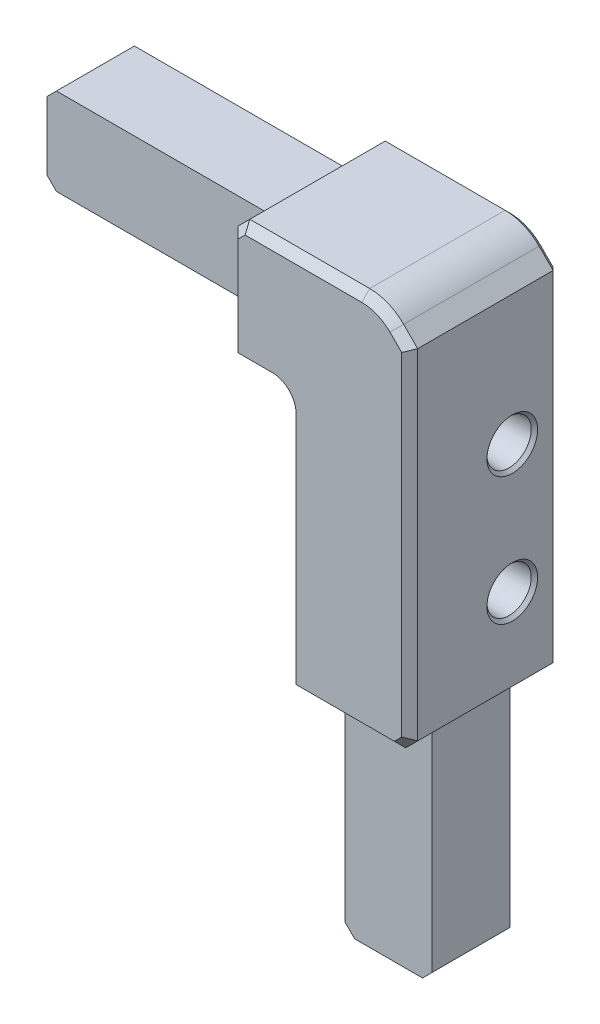
from build123d import *

# Parameters (mm, degrees)
BODY_DEPTH                   = 5.71
SIDE_TONGUE_SKETCH_W         = 10.88
SIDE_TONGUE_SKETCH_H         = 31
SIDE_TONGUE_DEPTH            = 4.875
END_TONGUE_SKETCH_W          = 31
END_TONGUE_SKETCH_H          = 10.88
END_TONGUE_DEPTH             = 4.875
WEB_DEPTH                    = 9.27
LIP_DEPTH                    = 1.81
BUMPER_CORNER_BED_SIDE_SIZE  = 3.516
BUMPER_CORNER_R              = 6
SHEET_CORNER_RELIEF_SKETCH_R = 1
SHEET_CORNER_RELIEF_DEPTH    = 1.75
REVEAL_CORNER_R              = 2
BODY_INSIDE_CORNER_R         = 2
ARM_ENDS_SIZE                = 1.5
TONGUE_LEAD_IN_SIZE          = 1.2
FRONT_FACE_CHAMFER_SIZE      = 1
BACK_FACE_CHAMFER_SIZE       = 0.6


with BuildPart() as part:
    # body sketch → body (new, symmetric)
    with BuildSketch(Plane.XY.offset(19.54)):
        Polygon((4.42, 7.07), (-18.08, 7.07), (-18.08, -8.13), (-10.78, -8.13), (-10.78, -40.43), (4.42, -40.43), align=None)
    extrude(amount=BODY_DEPTH, both=True)

    # side tongue sketch → side tongue (add, symmetric)
    with BuildSketch(Plane.XY.offset(20.375)):
        with Locations((-5.34, -54.93)):
            Rectangle(SIDE_TONGUE_SKETCH_W, SIDE_TONGUE_SKETCH_H)
    extrude(amount=SIDE_TONGUE_DEPTH, both=True)

    # end tongue sketch → end tongue (add, symmetric)
    with BuildSketch(Plane.XY.offset(20.375)):
        with Locations((-32.58, -2.69)):
            Rectangle(END_TONGUE_SKETCH_W, END_TONGUE_SKETCH_H)
    extrude(amount=END_TONGUE_DEPTH, both=True)

    # web sketch → web (add, symmetric)
    with BuildSketch(Plane.XY.offset(23.1)):
        Polygon((4.42, 7.07), (-18.08, 7.07), (-18.08, 3), (0.35, 3), (0.35, -40.43), (4.42, -40.43), align=None)
    extrude(amount=WEB_DEPTH, both=True)

    # lip sketch → lip (add, symmetric)
    with BuildSketch(Plane.XY.offset(30.56)):
        Polygon((4.42, 7.07), (-18.08, 7.07), (-18.08, -8.13), (-10.78, -8.13), (-10.78, -40.43), (4.42, -40.43), align=None)
    extrude(amount=LIP_DEPTH, both=True)

    # insert hole 1 sketch → insert hole 1 (revolve, cut)
    with BuildSketch(Plane.XY.offset(19.54)):
        Polygon((-3.58, -28.7), (5.42, -28.7), (5.42, -24.530439128), (4.02, -25.930439128), (-1.98, -26.35), (-3.58, -26.35), align=None)
    revolve(axis=Axis((-3.58, -28.7, 19.54), (1, 0, 0)), mode=Mode.SUBTRACT)

    # insert hole 2 sketch → insert hole 2 (revolve, cut)
    with BuildSketch(Plane.XY.offset(19.54)):
        Polygon((-3.58, -12.7), (5.42, -12.7), (5.42, -8.530439128), (4.02, -9.930439128), (-1.98, -10.35), (-3.58, -10.35), align=None)
    revolve(axis=Axis((-3.58, -12.7, 19.54), (1, 0, 0)), mode=Mode.SUBTRACT)

    # bumper corner, bed side
    bumper_corner_bed_side_edges = [part.edges().sort_by_distance(p)[0] for p in [
        (4.42, 7.07, 23.1),
    ]]
    chamfer(bumper_corner_bed_side_edges, length=BUMPER_CORNER_BED_SIDE_SIZE)

    # bumper corner
    bumper_corner_edges = [part.edges().sort_by_distance(p)[0] for p in [
        (0.904, 7.07, 23.1),
    ]]
    fillet(bumper_corner_edges, radius=BUMPER_CORNER_R)

    # sheet corner relief sketch → sheet corner relief (cut, symmetric)
    with BuildSketch(Plane.XY.offset(27)):
        with Locations((0.35, 3)):
            Circle(SHEET_CORNER_RELIEF_SKETCH_R)
    extrude(amount=SHEET_CORNER_RELIEF_DEPTH, both=True, mode=Mode.SUBTRACT)

    # reveal corner
    reveal_corner_edges = [part.edges().sort_by_distance(p)[0] for p in [
        (-10.78, -8.13, 30.56),
    ]]
    fillet(reveal_corner_edges, radius=REVEAL_CORNER_R)

    # body inside corner
    body_inside_corner_edges = [part.edges().sort_by_distance(p)[0] for p in [
        (-10.78, -8.13, 19.54),
    ]]
    fillet(body_inside_corner_edges, radius=BODY_INSIDE_CORNER_R)

    # arm ends
    arm_ends_edges = [part.edges().sort_by_distance(p)[0] for p in [
        (-18.08, 7.07, 23.1),
        (4.42, -40.43, 23.1),
    ]]
    chamfer(arm_ends_edges, length=ARM_ENDS_SIZE)

    # tongue lead-in
    tongue_lead_in_edges = [part.edges().sort_by_distance(p)[0] for p in [
        (-48.08, -8.13, 20.375),
        (-48.08, 2.75, 20.375),
        (-10.78, -70.43, 20.375),
        (0.1, -70.43, 20.375),
    ]]
    chamfer(tongue_lead_in_edges, length=TONGUE_LEAD_IN_SIZE)

    # front face chamfer
    front_face_chamfer_edges = [part.edges().sort_by_distance(p)[0] for p in [
        (0.71481922, 6.613277195, 32.37),
        (3.540679656, 4.433320344, 32.37),
        (4.42, -17.688, 32.37),
        (3.67, -39.68, 32.37),
        (-3.93, -40.43, 32.37),
        (-10.78, -25.28, 32.37),
        (-11.365786438, -8.715786438, 32.37),
        (-15.43, -8.13, 32.37),
        (-18.08, -1.28, 32.37),
        (-17.33, 6.32, 32.37),
        (-9.080640687, 7.07, 32.37),
    ]]
    chamfer(front_face_chamfer_edges, length=FRONT_FACE_CHAMFER_SIZE)

    # back face chamfer
    back_face_chamfer_edges = [part.edges().sort_by_distance(p)[0] for p in [
        (-15.43, -8.13, 13.83),
        (-11.365786438, -8.715786438, 13.83),
        (-10.78, -25.28, 13.83),
        (-3.93, -40.43, 13.83),
        (3.67, -39.68, 13.83),
        (4.42, -17.688, 13.83),
        (3.540679656, 4.433320344, 13.83),
        (0.71481922, 6.613277195, 13.83),
        (-9.080640687, 7.07, 13.83),
        (-17.33, 6.32, 13.83),
        (-18.08, -1.28, 13.83),
    ]]
    chamfer(back_face_chamfer_edges, length=BACK_FACE_CHAMFER_SIZE)


solid = part.part
